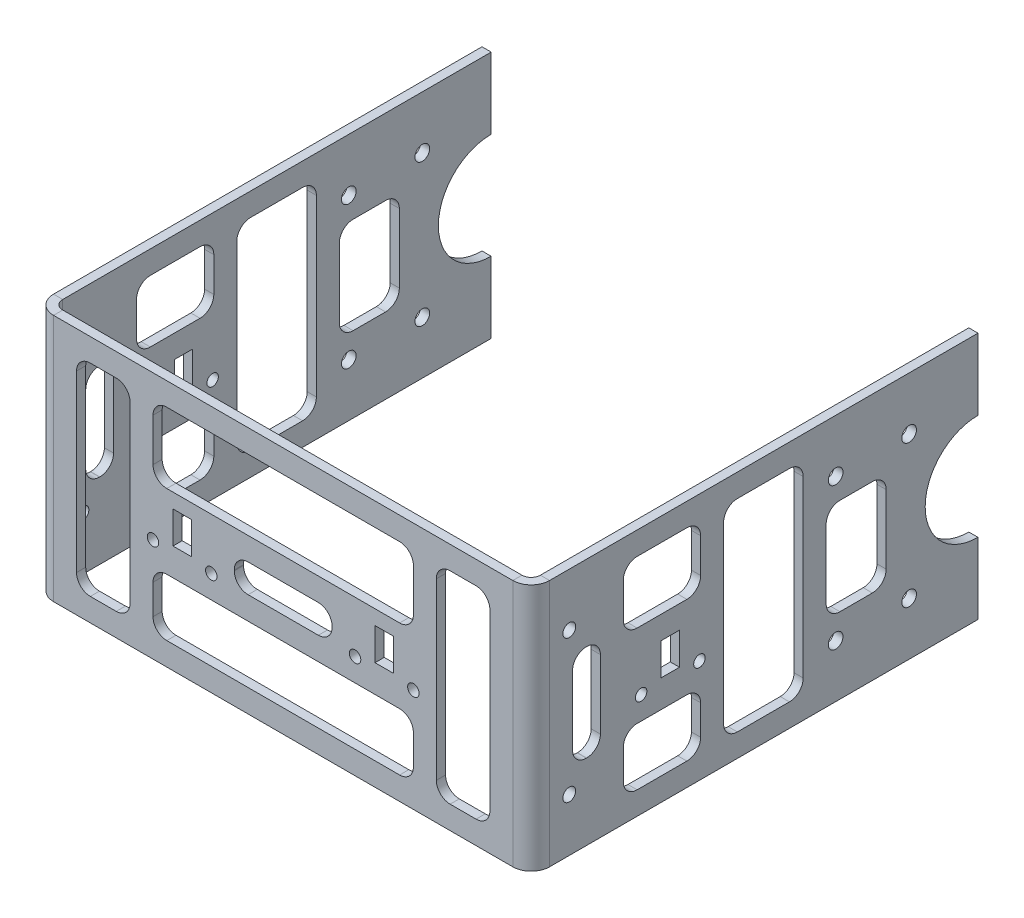
from build123d import *

# Parameters (mm, degrees)
SZKIC1_R                        = 1.6
SZKIC1_R_2                      = 1.25
SZKIC1_R_3                      = 1.4
SZKIC1_W                        = 4
SZKIC1_H                        = 7
DODANIE_WYCI_GNI_CIE2_DEPTH     = 2
SZKIC_START                     = -157.387814563
SZKIC_ZGI_CIA9_OUTLINE_W        = 54
SZKIC_ZGI_CIA9_OUTLINE_H        = 2
SZKIC_ZGI_CIA9_DEPTH            = 94.37752
SZKIC_START_2                   = -63.010294563
SZKIC_ZGI_CIA9_2_OUTLINE_R      = 1.6
SZKIC_ZGI_CIA9_2_OUTLINE_R_2    = 1.25
SZKIC_ZGI_CIA9_2_OUTLINE_R_3    = 1.4
SZKIC_ZGI_CIA9_2_OUTLINE_W      = 7
SZKIC_ZGI_CIA9_2_OUTLINE_H      = 4
SZKIC_ZGI_CIA9_2_DEPTH          = 1.62248
SZKIC_START_3                   = -63.387814563
SZKIC_ZGI_CIA9_3_OUTLINE_R      = 1.6
SZKIC_ZGI_CIA9_3_OUTLINE_R_2    = 1.25
SZKIC_ZGI_CIA9_3_OUTLINE_R_3    = 1.4
SZKIC_ZGI_CIA9_3_OUTLINE_W      = 7
SZKIC_ZGI_CIA9_3_OUTLINE_H      = 4
SZKIC_ZGI_CIA9_3_DEPTH          = 2.77752
SZKIC_START_4                   = -27.35389443
SZKIC_ZGI_CIA9_4_DEPTH          = 55.35389443
SZKIC_ZGI_CIA9_5_DEPTH          = 54
SZKIC_START_5                   = 44.189705437
SZKIC_ZGI_CIA10_OUTLINE_W       = 54
SZKIC_ZGI_CIA10_OUTLINE_H       = 2
SZKIC_ZGI_CIA10_DEPTH           = 94.42248
SZKIC_START_6                   = 40.612185437
SZKIC_ZGI_CIA10_2_OUTLINE_R     = 1.6
SZKIC_ZGI_CIA10_2_OUTLINE_R_2   = 1.25
SZKIC_ZGI_CIA10_2_OUTLINE_R_3   = 1.4
SZKIC_ZGI_CIA10_2_OUTLINE_W     = 7
SZKIC_ZGI_CIA10_2_OUTLINE_H     = 4
SZKIC_ZGI_CIA10_2_DEPTH         = 4
SZKIC_ZGI_CIA10_3_DEPTH         = 54
WYTNIJ_WYCI_GNI_CIE1_DEPTH      = 3
WYTNIJ_WYCI_GNI_CIE2_DEPTH      = 147.601379101
WYTNIJ_WYCI_GNI_CIE2_DEPTH_BACK = 147.601379101


with BuildPart() as part:
    # Szkic1 → Dodanie-wyciągnięcie2 (new body)
    with BuildSketch(Plane.XY):
        with BuildLine():
            Line((-157.387814563, 26.64610557), (-157.387814563, 11.14610557))
            ThreePointArc((-157.387814563, 11.14610557), (-145.887814563, -0.35389443), (-157.387814563, -11.85389443))
            Line((-157.387814563, -11.85389443), (-157.387814563, -27.35389443))
            Line((-157.387814563, -27.35389443), (-54.387814563, -27.35389443))
            Line((-54.387814563, -27.35389443), (35.612185437, -27.35389443))
            Line((35.612185437, -27.35389443), (138.612185437, -27.35389443))
            Line((138.612185437, -27.35389443), (138.612185437, -11.85389443))
            ThreePointArc((138.612185437, -11.85389443), (127.112185437, -0.35389443), (138.612185437, 11.14610557))
            Line((138.612185437, 11.14610557), (138.612185437, 26.64610557))
            Line((138.612185437, 26.64610557), (-157.387814563, 26.64610557))
        make_face()
        with Locations((-126.387814563, -15.85389443)):
            Circle(SZKIC1_R, mode=Mode.SUBTRACT)
        with Locations((-126.387814563, 15.14610557)):
            Circle(SZKIC1_R, mode=Mode.SUBTRACT)
        with Locations((107.612185437, -15.85389443)):
            Circle(SZKIC1_R, mode=Mode.SUBTRACT)
        with Locations((107.612185437, 15.14610557)):
            Circle(SZKIC1_R, mode=Mode.SUBTRACT)
        with Locations((123.612185437, -15.85389443)):
            Circle(SZKIC1_R, mode=Mode.SUBTRACT)
        with Locations((123.612185437, 15.14610557)):
            Circle(SZKIC1_R, mode=Mode.SUBTRACT)
        with Locations((-142.387814563, -15.85389443)):
            Circle(SZKIC1_R, mode=Mode.SUBTRACT)
        with Locations((-142.387814563, 15.14610557)):
            Circle(SZKIC1_R, mode=Mode.SUBTRACT)
        with Locations((-37.737814563, -4.85389443)):
            Circle(SZKIC1_R_2, mode=Mode.SUBTRACT)
        with Locations((-25.037814563, -4.85389443)):
            Circle(SZKIC1_R_2, mode=Mode.SUBTRACT)
        with Locations((6.262185437, -4.85389443)):
            Circle(SZKIC1_R_2, mode=Mode.SUBTRACT)
        with Locations((18.962185437, -4.85389443)):
            Circle(SZKIC1_R_2, mode=Mode.SUBTRACT)
        with Locations((65.262185437, -4.85389443)):
            Circle(SZKIC1_R_2, mode=Mode.SUBTRACT)
        with Locations((77.962185437, -4.85389443)):
            Circle(SZKIC1_R_2, mode=Mode.SUBTRACT)
        with Locations((-96.737814563, -4.85389443)):
            Circle(SZKIC1_R_2, mode=Mode.SUBTRACT)
        with Locations((-84.037814563, -4.85389443)):
            Circle(SZKIC1_R_2, mode=Mode.SUBTRACT)
        with Locations((-68.387814563, -15.85389443)):
            Circle(SZKIC1_R_3, mode=Mode.SUBTRACT)
        with Locations((-68.387814563, 15.14610557)):
            Circle(SZKIC1_R_3, mode=Mode.SUBTRACT)
        with Locations((49.612185437, -15.85389443)):
            Circle(SZKIC1_R_3, mode=Mode.SUBTRACT)
        with Locations((49.612185437, 15.14610557)):
            Circle(SZKIC1_R_3, mode=Mode.SUBTRACT)
        with Locations((-31.387814563, -0.35389443)):
            Rectangle(SZKIC1_W, SZKIC1_H, mode=Mode.SUBTRACT)
        with Locations((12.612185437, -0.35389443)):
            Rectangle(SZKIC1_W, SZKIC1_H, mode=Mode.SUBTRACT)
        with Locations((71.612185437, -0.35389443)):
            Rectangle(SZKIC1_W, SZKIC1_H, mode=Mode.SUBTRACT)
        with Locations((-90.387814563, -0.35389443)):
            Rectangle(SZKIC1_W, SZKIC1_H, mode=Mode.SUBTRACT)
    extrude(amount=DODANIE_WYCI_GNI_CIE2_DEPTH)

    # Szkic zgięcia9: read off the stored shape, not the designer's step
    # Szkic zgięcia9 outline → Szkic zgięcia9 (cut)
    with BuildSketch(Plane.YZ.offset(SZKIC_START)):
        with Locations((-0.35389443, 1)):
            Rectangle(SZKIC_ZGI_CIA9_OUTLINE_W, SZKIC_ZGI_CIA9_OUTLINE_H)
    extrude(amount=SZKIC_ZGI_CIA9_DEPTH, mode=Mode.SUBTRACT)

    # Szkic zgi_cia9 2 outline → Szkic zgi_cia9 2 (add)
    with BuildSketch(Plane.YZ.offset(SZKIC_START_2)):
        with BuildLine():
            Line((-27.35389443, 0), (-27.35389443, -95.28761102))
            Line((-27.35389443, -95.28761102), (-11.85389443, -95.28761102))
            ThreePointArc((-11.85389443, -95.28761102), (-0.35389443, -83.78761102), (11.14610557, -95.28761102))
            Line((11.14610557, -95.28761102), (26.64610557, -95.28761102))
            Line((26.64610557, -95.28761102), (26.64610557, 0))
            Line((26.64610557, 0), (-27.35389443, 0))
        make_face()
        with Locations((-15.85389443, -80.28761102)):
            Circle(SZKIC_ZGI_CIA9_2_OUTLINE_R, mode=Mode.SUBTRACT)
        with Locations((-15.85389443, -64.28761102)):
            Circle(SZKIC_ZGI_CIA9_2_OUTLINE_R, mode=Mode.SUBTRACT)
        with Locations((15.14610557, -80.28761102)):
            Circle(SZKIC_ZGI_CIA9_2_OUTLINE_R, mode=Mode.SUBTRACT)
        with Locations((15.14610557, -64.28761102)):
            Circle(SZKIC_ZGI_CIA9_2_OUTLINE_R, mode=Mode.SUBTRACT)
        with Locations((-4.85389443, -34.63761102)):
            Circle(SZKIC_ZGI_CIA9_2_OUTLINE_R_2, mode=Mode.SUBTRACT)
        with Locations((-15.85389443, -6.28761102)):
            Circle(SZKIC_ZGI_CIA9_2_OUTLINE_R_3, mode=Mode.SUBTRACT)
        with Locations((-4.85389443, -21.93761102)):
            Circle(SZKIC_ZGI_CIA9_2_OUTLINE_R_2, mode=Mode.SUBTRACT)
        with Locations((-0.35389443, -28.28761102)):
            Rectangle(SZKIC_ZGI_CIA9_2_OUTLINE_W, SZKIC_ZGI_CIA9_2_OUTLINE_H, mode=Mode.SUBTRACT)
        with Locations((15.14610557, -6.28761102)):
            Circle(SZKIC_ZGI_CIA9_2_OUTLINE_R_3, mode=Mode.SUBTRACT)
    extrude(amount=SZKIC_ZGI_CIA9_2_DEPTH)

    # Szkic zgi_cia9 3 outline → Szkic zgi_cia9 3 (add)
    with BuildSketch(Plane.YZ.offset(SZKIC_START_3)):
        with BuildLine():
            Line((-27.35389443, 0), (-27.35389443, -95.28761102))
            Line((-27.35389443, -95.28761102), (-11.85389443, -95.28761102))
            ThreePointArc((-11.85389443, -95.28761102), (-0.35389443, -83.78761102), (11.14610557, -95.28761102))
            Line((11.14610557, -95.28761102), (26.64610557, -95.28761102))
            Line((26.64610557, -95.28761102), (26.64610557, 0))
            Line((26.64610557, 0), (-27.35389443, 0))
        make_face()
        with Locations((-15.85389443, -80.28761102)):
            Circle(SZKIC_ZGI_CIA9_3_OUTLINE_R, mode=Mode.SUBTRACT)
        with Locations((-15.85389443, -64.28761102)):
            Circle(SZKIC_ZGI_CIA9_3_OUTLINE_R, mode=Mode.SUBTRACT)
        with Locations((15.14610557, -80.28761102)):
            Circle(SZKIC_ZGI_CIA9_3_OUTLINE_R, mode=Mode.SUBTRACT)
        with Locations((15.14610557, -64.28761102)):
            Circle(SZKIC_ZGI_CIA9_3_OUTLINE_R, mode=Mode.SUBTRACT)
        with Locations((-4.85389443, -34.63761102)):
            Circle(SZKIC_ZGI_CIA9_3_OUTLINE_R_2, mode=Mode.SUBTRACT)
        with Locations((-15.85389443, -6.28761102)):
            Circle(SZKIC_ZGI_CIA9_3_OUTLINE_R_3, mode=Mode.SUBTRACT)
        with Locations((-4.85389443, -21.93761102)):
            Circle(SZKIC_ZGI_CIA9_3_OUTLINE_R_2, mode=Mode.SUBTRACT)
        with Locations((-0.35389443, -28.28761102)):
            Rectangle(SZKIC_ZGI_CIA9_3_OUTLINE_W, SZKIC_ZGI_CIA9_3_OUTLINE_H, mode=Mode.SUBTRACT)
        with Locations((15.14610557, -6.28761102)):
            Circle(SZKIC_ZGI_CIA9_3_OUTLINE_R_3, mode=Mode.SUBTRACT)
    extrude(amount=SZKIC_ZGI_CIA9_3_DEPTH)

    # Szkic zgi_cia9 4 outline → Szkic zgi_cia9 4 (cut)
    with BuildSketch(Plane(origin=(0, 0, 0), x_dir=(1, 0, 0), z_dir=(0, 1, 0)).offset(SZKIC_START_4)):
        with BuildLine():
            Line((-60.610294563, 95.28761102), (-61.387814563, 95.28761102))
            Line((-61.387814563, 95.28761102), (-61.387814563, 2))
            ThreePointArc((-61.387814563, 2), (-61.1829413, 1.118229055), (-60.610294563, 0.4171094))
            Line((-60.610294563, 0.4171094), (-60.610294563, 95.28761102))
        make_face()
        with BuildLine():
            ThreePointArc((-59.387814563, -2), (-62.216241688, -0.828427125), (-63.387814563, 2))
            Line((-63.387814563, 2), (-63.387814563, 0))
            Line((-63.387814563, 0), (-63.010294563, 0))
            Line((-63.010294563, 0), (-63.010294563, -2))
            Line((-63.010294563, -2), (-59.387814563, -2))
        make_face()
    extrude(amount=SZKIC_ZGI_CIA9_4_DEPTH, mode=Mode.SUBTRACT)

    # Szkic zgi_cia9 5 outline → Szkic zgi_cia9 5 (add)
    with BuildSketch(Plane(origin=(0, 0, 0), x_dir=(1, 0, 0), z_dir=(0, 1, 0)).offset(SZKIC_START_4)):
        with BuildLine():
            ThreePointArc((-59.387814563, 0), (-60.033654637, 0.107147497), (-60.610294563, 0.4171094))
            Line((-60.610294563, 0.4171094), (-60.610294563, 0))
            Line((-60.610294563, 0), (-59.387814563, 0))
        make_face()
    extrude(amount=SZKIC_ZGI_CIA9_5_DEPTH)

    # Szkic zgięcia10: read off the stored shape, not the designer's step
    # Szkic zgięcia10 outline → Szkic zgięcia10 (cut)
    with BuildSketch(Plane.YZ.offset(SZKIC_START_5)):
        with Locations((-0.35389443, 1)):
            Rectangle(SZKIC_ZGI_CIA10_OUTLINE_W, SZKIC_ZGI_CIA10_OUTLINE_H)
    extrude(amount=SZKIC_ZGI_CIA10_DEPTH, mode=Mode.SUBTRACT)

    # Szkic zgi_cia10 2 outline → Szkic zgi_cia10 2 (add)
    with BuildSketch(Plane.YZ.offset(SZKIC_START_6)):
        with BuildLine():
            Line((26.64610557, 0), (-27.35389443, 0))
            Line((-27.35389443, 0), (-27.35389443, -95.28761102))
            Line((-27.35389443, -95.28761102), (-11.85389443, -95.28761102))
            ThreePointArc((-11.85389443, -95.28761102), (-0.35389443, -83.78761102), (11.14610557, -95.28761102))
            Line((11.14610557, -95.28761102), (26.64610557, -95.28761102))
            Line((26.64610557, -95.28761102), (26.64610557, 0))
        make_face()
        with Locations((-15.85389443, -80.28761102)):
            Circle(SZKIC_ZGI_CIA10_2_OUTLINE_R, mode=Mode.SUBTRACT)
        with Locations((-15.85389443, -64.28761102)):
            Circle(SZKIC_ZGI_CIA10_2_OUTLINE_R, mode=Mode.SUBTRACT)
        with Locations((15.14610557, -80.28761102)):
            Circle(SZKIC_ZGI_CIA10_2_OUTLINE_R, mode=Mode.SUBTRACT)
        with Locations((15.14610557, -64.28761102)):
            Circle(SZKIC_ZGI_CIA10_2_OUTLINE_R, mode=Mode.SUBTRACT)
        with Locations((-4.85389443, -34.63761102)):
            Circle(SZKIC_ZGI_CIA10_2_OUTLINE_R_2, mode=Mode.SUBTRACT)
        with Locations((-15.85389443, -6.28761102)):
            Circle(SZKIC_ZGI_CIA10_2_OUTLINE_R_3, mode=Mode.SUBTRACT)
        with Locations((-4.85389443, -21.93761102)):
            Circle(SZKIC_ZGI_CIA10_2_OUTLINE_R_2, mode=Mode.SUBTRACT)
        with Locations((-0.35389443, -28.28761102)):
            Rectangle(SZKIC_ZGI_CIA10_2_OUTLINE_W, SZKIC_ZGI_CIA10_2_OUTLINE_H, mode=Mode.SUBTRACT)
        with Locations((15.14610557, -6.28761102)):
            Circle(SZKIC_ZGI_CIA10_2_OUTLINE_R_3, mode=Mode.SUBTRACT)
    extrude(amount=SZKIC_ZGI_CIA10_2_DEPTH)

    # Szkic zgi_cia10 3 outline → Szkic zgi_cia10 3 (cut)
    with BuildSketch(Plane(origin=(0, 0, 0), x_dir=(1, 0, 0), z_dir=(0, 1, 0)).offset(SZKIC_START_4)):
        with BuildLine():
            ThreePointArc((44.612185437, 2), (43.440612562, -0.828427125), (40.612185437, -2))
            Line((40.612185437, -2), (44.189705437, -2))
            Line((44.189705437, -2), (44.189705437, 0))
            Line((44.189705437, 0), (44.612185437, 0))
            Line((44.612185437, 0), (44.612185437, 2))
        make_face()
        with BuildLine():
            ThreePointArc((40.612185437, 0), (42.026398999, 0.585786438), (42.612185437, 2))
            Line((42.612185437, 2), (42.612185437, 95.28761102))
            Line((42.612185437, 95.28761102), (40.612185437, 95.28761102))
            Line((40.612185437, 95.28761102), (40.612185437, 0))
        make_face()
    extrude(amount=SZKIC_ZGI_CIA10_3_DEPTH, mode=Mode.SUBTRACT)

    # Szkic35 → Wytnij-wyciągnięcie1 (cut)
    with BuildSketch(Plane.XY.offset(2)):
        with BuildLine():
            Line((32.612185437, -22.35389443), (26.962185437, -22.35389443))
            ThreePointArc((26.962185437, -22.35389443), (24.840865093, -21.475214774), (23.962185437, -19.35389443))
            Line((23.962185437, -19.35389443), (23.962185437, 18.64610557))
            ThreePointArc((23.962185437, 18.64610557), (24.840865093, 20.767425913), (26.962185437, 21.64610557))
            Line((26.962185437, 21.64610557), (32.612185437, 21.64610557))
            ThreePointArc((32.612185437, 21.64610557), (34.73350578, 20.767425913), (35.612185437, 18.64610557))
            Line((35.612185437, 18.64610557), (35.612185437, -19.35389443))
            ThreePointArc((35.612185437, -19.35389443), (34.73350578, -21.475214774), (32.612185437, -22.35389443))
        make_face()
        with BuildLine():
            Line((15.962185437, -22.35389443), (-34.737814563, -22.35389443))
            ThreePointArc((-34.737814563, -22.35389443), (-36.859134907, -21.475214774), (-37.737814563, -19.35389443))
            Line((-37.737814563, -19.35389443), (-37.737814563, -12.85389443))
            ThreePointArc((-37.737814563, -12.85389443), (-36.859134907, -10.732574087), (-34.737814563, -9.85389443))
            Line((-34.737814563, -9.85389443), (15.962185437, -9.85389443))
            ThreePointArc((15.962185437, -9.85389443), (18.08350578, -10.732574087), (18.962185437, -12.85389443))
            Line((18.962185437, -12.85389443), (18.962185437, -19.35389443))
            ThreePointArc((18.962185437, -19.35389443), (18.08350578, -21.475214774), (15.962185437, -22.35389443))
        make_face()
        with BuildLine():
            Line((15.962185437, 6.318796925), (-34.737814563, 6.318796925))
            ThreePointArc((-34.737814563, 6.318796925), (-36.859134907, 7.197476582), (-37.737814563, 9.318796925))
            Line((-37.737814563, 9.318796925), (-37.737814563, 18.64610557))
            ThreePointArc((-37.737814563, 18.64610557), (-36.859134907, 20.767425913), (-34.737814563, 21.64610557))
            Line((-34.737814563, 21.64610557), (15.962185437, 21.64610557))
            ThreePointArc((15.962185437, 21.64610557), (18.08350578, 20.767425913), (18.962185437, 18.64610557))
            Line((18.962185437, 18.64610557), (18.962185437, 9.318796925))
            ThreePointArc((18.962185437, 9.318796925), (18.08350578, 7.197476582), (15.962185437, 6.318796925))
        make_face()
        with BuildLine():
            Line((-1.737814563, -4.85389443), (-17.037814563, -4.85389443))
            ThreePointArc((-17.037814563, -4.85389443), (-19.159134907, -3.975214774), (-20.037814563, -1.85389443))
            Line((-20.037814563, -1.85389443), (-20.037814563, -1.681203075))
            ThreePointArc((-20.037814563, -1.681203075), (-19.159134907, 0.440117269), (-17.037814563, 1.318796925))
            Line((-17.037814563, 1.318796925), (-1.737814563, 1.318796925))
            ThreePointArc((-1.737814563, 1.318796925), (0.38350578, 0.440117269), (1.262185437, -1.681203075))
            Line((1.262185437, -1.681203075), (1.262185437, -1.85389443))
            ThreePointArc((1.262185437, -1.85389443), (0.38350578, -3.975214774), (-1.737814563, -4.85389443))
        make_face()
        with BuildLine():
            Line((-45.737814563, -22.35389443), (-51.387814563, -22.35389443))
            ThreePointArc((-51.387814563, -22.35389443), (-53.509134907, -21.475214774), (-54.387814563, -19.35389443))
            Line((-54.387814563, -19.35389443), (-54.387814563, 18.64610557))
            ThreePointArc((-54.387814563, 18.64610557), (-53.509134907, 20.767425913), (-51.387814563, 21.64610557))
            Line((-51.387814563, 21.64610557), (-45.737814563, 21.64610557))
            ThreePointArc((-45.737814563, 21.64610557), (-43.61649422, 20.767425913), (-42.737814563, 18.64610557))
            Line((-42.737814563, 18.64610557), (-42.737814563, -19.35389443))
            ThreePointArc((-42.737814563, -19.35389443), (-43.61649422, -21.475214774), (-45.737814563, -22.35389443))
        make_face()
    extrude(amount=-WYTNIJ_WYCI_GNI_CIE1_DEPTH, mode=Mode.SUBTRACT)

    # Szkic36 → Wytnij-wyciągnięcie2 (cut, two sides: drawn at the far end of the back side and taken through both)
    with BuildSketch(Plane.ZY.offset(63.387814563).offset(-WYTNIJ_WYCI_GNI_CIE2_DEPTH_BACK)):
        with BuildLine():
            Line((-54.225756634, 21.64610557), (-42.89162669, 21.64610557))
            ThreePointArc((-42.89162669, 21.64610557), (-40.770306346, 20.767425913), (-39.89162669, 18.64610557))
            Line((-39.89162669, 18.64610557), (-39.89162669, -19.35389443))
            ThreePointArc((-39.89162669, -19.35389443), (-40.770306346, -21.475214774), (-42.89162669, -22.35389443))
            Line((-42.89162669, -22.35389443), (-54.225756634, -22.35389443))
            ThreePointArc((-54.225756634, -22.35389443), (-56.347076977, -21.475214774), (-57.225756634, -19.35389443))
            Line((-57.225756634, -19.35389443), (-57.225756634, 18.64610557))
            ThreePointArc((-57.225756634, 18.64610557), (-56.347076977, 20.767425913), (-54.225756634, 21.64610557))
        make_face()
        with BuildLine():
            Line((-72.28761102, 10.14610557), (-65.225756634, 10.14610557))
            ThreePointArc((-65.225756634, 10.14610557), (-63.10443629, 9.267425913), (-62.225756634, 7.14610557))
            Line((-62.225756634, 7.14610557), (-62.225756634, -7.85389443))
            ThreePointArc((-62.225756634, -7.85389443), (-63.10443629, -9.975214774), (-65.225756634, -10.85389443))
            Line((-65.225756634, -10.85389443), (-72.28761102, -10.85389443))
            ThreePointArc((-72.28761102, -10.85389443), (-74.408931363, -9.975214774), (-75.28761102, -7.85389443))
            Line((-75.28761102, -7.85389443), (-75.28761102, 7.14610557))
            ThreePointArc((-75.28761102, 7.14610557), (-74.408931363, 9.267425913), (-72.28761102, 10.14610557))
        make_face()
        with BuildLine():
            Line((-31.89162669, 21.64610557), (-21.063119476, 21.64610557))
            ThreePointArc((-21.063119476, 21.64610557), (-18.941799132, 20.767425913), (-18.063119476, 18.64610557))
            Line((-18.063119476, 18.64610557), (-18.063119476, 11.14610557))
            ThreePointArc((-18.063119476, 11.14610557), (-18.941799132, 9.024785226), (-21.063119476, 8.14610557))
            Line((-21.063119476, 8.14610557), (-31.89162669, 8.14610557))
            ThreePointArc((-31.89162669, 8.14610557), (-34.012947033, 9.024785226), (-34.89162669, 11.14610557))
            Line((-34.89162669, 11.14610557), (-34.89162669, 18.64610557))
            ThreePointArc((-34.89162669, 18.64610557), (-34.012947033, 20.767425913), (-31.89162669, 21.64610557))
        make_face()
        with BuildLine():
            Line((-31.89162669, -9.85389443), (-21.063119476, -9.85389443))
            ThreePointArc((-21.063119476, -9.85389443), (-18.941799132, -10.732574087), (-18.063119476, -12.85389443))
            Line((-18.063119476, -12.85389443), (-18.063119476, -19.35389443))
            ThreePointArc((-18.063119476, -19.35389443), (-18.941799132, -21.475214774), (-21.063119476, -22.35389443))
            Line((-21.063119476, -22.35389443), (-31.89162669, -22.35389443))
            ThreePointArc((-31.89162669, -22.35389443), (-34.012947033, -21.475214774), (-34.89162669, -19.35389443))
            Line((-34.89162669, -19.35389443), (-34.89162669, -12.85389443))
            ThreePointArc((-34.89162669, -12.85389443), (-34.012947033, -10.732574087), (-31.89162669, -9.85389443))
        make_face()
        with BuildLine():
            Line((-10.063119476, 10.14610557), (-10, 10.14610557))
            ThreePointArc((-10, 10.14610557), (-7.878679656, 9.267425913), (-7, 7.14610557))
            Line((-7, 7.14610557), (-7, -7.85389443))
            ThreePointArc((-7, -7.85389443), (-7.878679656, -9.975214774), (-10, -10.85389443))
            Line((-10, -10.85389443), (-10.063119476, -10.85389443))
            ThreePointArc((-10.063119476, -10.85389443), (-12.184439819, -9.975214774), (-13.063119476, -7.85389443))
            Line((-13.063119476, -7.85389443), (-13.063119476, 7.14610557))
            ThreePointArc((-13.063119476, 7.14610557), (-12.184439819, 9.267425913), (-10.063119476, 10.14610557))
        make_face()
    extrude(amount=WYTNIJ_WYCI_GNI_CIE2_DEPTH + WYTNIJ_WYCI_GNI_CIE2_DEPTH_BACK, mode=Mode.SUBTRACT)


solid = part.part
